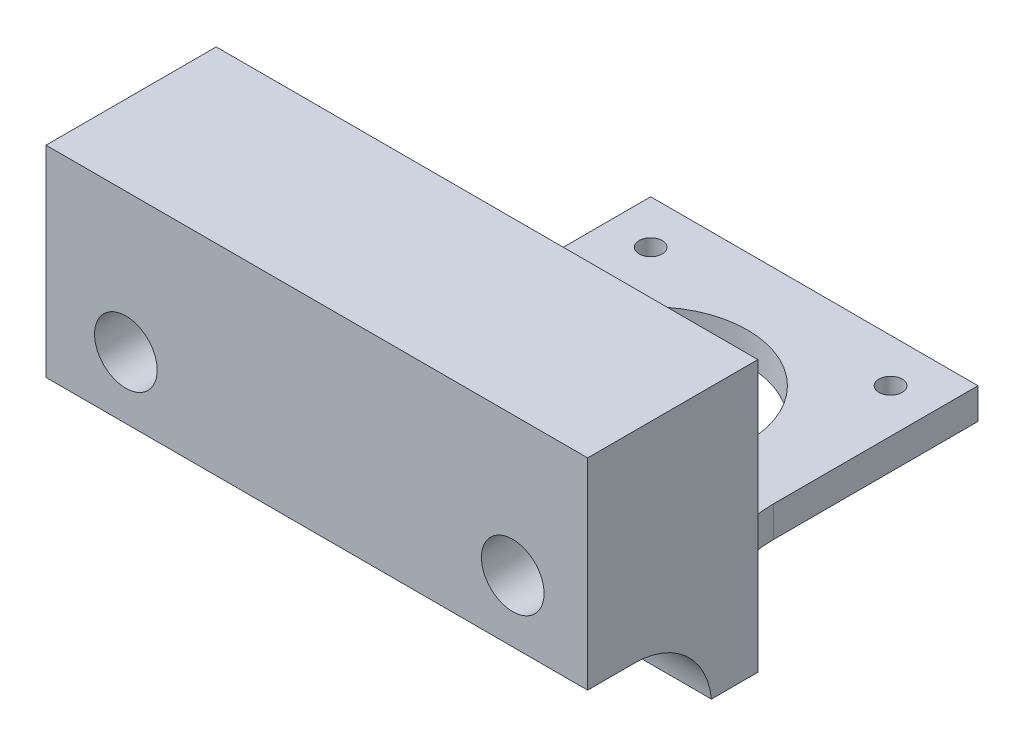
from build123d import *

# Parameters (mm, degrees)
SKETCH1_W           = 42.3
SKETCH1_H           = 42.3
SKETCH1_R           = 1.5
SKETCH1_R_2         = 12.5
BOSS_EXTRUDE1_DEPTH = 4
SKETCH2_W           = 70
SKETCH2_H           = 35
BOSS_EXTRUDE3_DEPTH = 6
SKETCH5_W           = 70
SKETCH5_H           = 26
SKETCH5_R           = 4.05
BOSS_EXTRUDE7_DEPTH = 16
CUT_EXTRUDE1_START  = -16
SKETCH5_2_R         = 4.05
CUT_EXTRUDE1_DEPTH  = 16
FILLET1_R           = 16
FILLET2_R           = 10
FILLET4_R           = 2


with BuildPart() as part:
    # Sketch1 → Boss-Extrude1 (new body)
    with BuildSketch(Plane(origin=(0, 0, 0), x_dir=(1, 0, 0), z_dir=(0, 1, 0))):
        Rectangle(SKETCH1_W, SKETCH1_H)
        with Locations(Location((-15.5, 15.5, 0), (0, 0, 270))):
            Circle(SKETCH1_R, mode=Mode.SUBTRACT)
        with Locations(Location((15.5, 15.5, 0), (0, 0, 270))):
            Circle(SKETCH1_R, mode=Mode.SUBTRACT)
        with Locations(Location((15.5, -15.5, 0), (0, 0, 270))):
            Circle(SKETCH1_R, mode=Mode.SUBTRACT)
        with Locations(Location((-15.5, -15.5, 0), (0, 0, 270))):
            Circle(SKETCH1_R, mode=Mode.SUBTRACT)
        with Locations(Location((0, 0, 0), (0, 0, 270))):
            Circle(SKETCH1_R_2, mode=Mode.SUBTRACT)
    extrude(amount=BOSS_EXTRUDE1_DEPTH)

    # Sketch2 → Boss-Extrude3 (add)
    with BuildSketch(Plane.XY.offset(21.15)):
        with Locations((0, 17.5)):
            Rectangle(SKETCH2_W, SKETCH2_H)
    extrude(amount=BOSS_EXTRUDE3_DEPTH)

    # Sketch5 → Boss-Extrude7 (add)
    with BuildSketch(Plane.XY.offset(27.15)):
        with Locations((0, 22)):
            Rectangle(SKETCH5_W, SKETCH5_H)
        with Locations((-24.679036529, 17)):
            Circle(SKETCH5_R, mode=Mode.SUBTRACT)
        with Locations((25.320963471, 17)):
            Circle(SKETCH5_R, mode=Mode.SUBTRACT)
    extrude(amount=BOSS_EXTRUDE7_DEPTH)

    # Sketch5<2> → Cut-Extrude1 (cut)
    with BuildSketch(Plane.XY.offset(27.15).offset(CUT_EXTRUDE1_START)):
        with Locations((-24.679036529, 17)):
            Circle(SKETCH5_2_R)
        with Locations((25.320963471, 17)):
            Circle(SKETCH5_2_R)
    extrude(amount=CUT_EXTRUDE1_DEPTH, mode=Mode.SUBTRACT)

    # Fillet1
    # the kernel refuses this fillet: 16 mm, written as the material it adds along each edge
    with BuildSketch(Plane(origin=(21.15, 0, 21.15), x_dir=(1, 0, 0), z_dir=(0, 1, 0))) as fillet1_piece_1:
        with BuildLine():
            CenterArc((16, 15.854888836), FILLET1_R, 180, 82.27751927)
            Line((0, 15.854888836), (-0.32, 15.854888836))
            Line((-0.32, 15.854888836), (-0.32, 0))
            Line((-0.32, 0), (0, -0.32))
            ThreePointArc((0, -0.32), (6.925, -0.32), (13.807, -0.317097777))
            Line((13.807, -0.317097777), (13.85, 0))
        make_face()
    extrude(amount=4)
    with BuildSketch(Plane(origin=(-21.15, 0, 21.15), x_dir=(-1, 0, 0), z_dir=(0, 1, 0))) as fillet1_piece_2:
        with BuildLine():
            CenterArc((16, -15.854888836), FILLET1_R, 97.72248073, 82.27751927)
            Line((0, -15.854888836), (-0.32, -15.854888836))
            Line((-0.32, -15.854888836), (-0.32, 0))
            Line((-0.32, 0), (0, 0.32))
            ThreePointArc((0, 0.32), (6.925, 0.32), (13.807, 0.317097777))
            Line((13.807, 0.317097777), (13.85, 0))
        make_face()
    extrude(amount=4)

    # Fillet2
    # the kernel refuses this fillet: 10 mm, written as the material it adds along each edge
    with BuildSketch(Plane(origin=(35, 9, 27.15), x_dir=(0, 0, 1), z_dir=(-1, 0, 0))) as fillet2_piece_1:
        with BuildLine():
            CenterArc((9.949874371, -10), FILLET2_R, 90, 84.260829523)
            Line((0, -9), (-0.198997487, -8.98))
            ThreePointArc((-0.198997487, -8.98), (-0.2, -4.5), (-0.2, 0))
            Line((-0.2, 0), (0, 0.2))
            Line((0, 0.2), (9.949874371, 0.2))
            Line((9.949874371, 0.2), (9.949874371, 0))
        make_face()
    extrude(amount=70)

    # Fillet4
    # the kernel refuses this fillet: 2 mm, written as the material it adds along each edge
    with BuildSketch(Plane(origin=(-35, 4, 21.15), x_dir=(0, 1, 0), z_dir=(1, 0, 0))) as fillet4_piece_1_section:
        with BuildLine():
            CenterArc((FILLET4_R, -FILLET4_R), FILLET4_R, 90, 90)
            Line((0, -FILLET4_R), (0, 0))
            Line((0, 0), (FILLET4_R, 0))
        make_face()
    fillet4_piece_1 = extrude(amount=70, mode=Mode.PRIVATE)
    fillet4_piece_1 = fillet4_piece_1 - Plane(origin=(-37.15, 4.464640399, 5.295111164), x_dir=(-1, 0, 0), z_dir=(0, -1, 0)) * Cylinder(16, 148, mode=Mode.PRIVATE)
    fillet4_piece_1 = fillet4_piece_1 - Plane(origin=(37.15, 4.464640399, 5.295111164), x_dir=(1, 0, 0), z_dir=(0, -1, 0)) * Cylinder(16, 148, mode=Mode.PRIVATE)
    add(fillet4_piece_1)


solid = part.part
